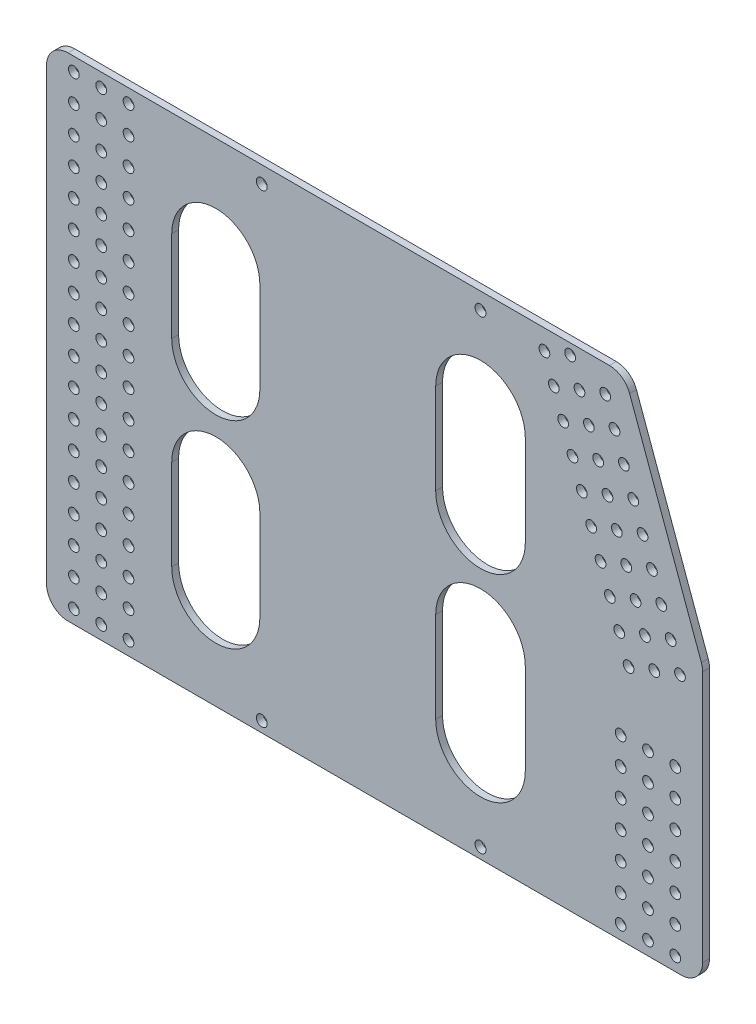
from build123d import *

# Parameters (mm, degrees)
SKETCH3_R           = 2.4892
SKETCH3_R_2         = 14.2875
BOSS_EXTRUDE3_DEPTH = 3.175
FILLET2_R           = 10
BOSS_EXTRUDE5_START = -3.175
SKETCH5_R           = 14.2875
SKETCH5_R_2         = 2.4892
BOSS_EXTRUDE5_DEPTH = 3.175
SKETCH6_R           = 2.54
CUT_EXTRUDE1_DEPTH  = 3.175


with BuildPart() as part:
    # Sketch3 → Boss-Extrude3 (new body)
    with BuildSketch(Plane.XY):
        Polygon((-62.034734806, 275.060295422), (206.435304788, 275.060295422), (242.765265194, 175.244549557), (242.765265194, 46.460295422), (-62.034734806, 46.460295422), align=None)
        with Locations((123.22406409, 114.608841068)):
            Circle(SKETCH3_R, mode=Mode.SUBTRACT)
        with Locations((87.05446409, 114.608841068)):
            Circle(SKETCH3_R, mode=Mode.SUBTRACT)
        with Locations((-49.334734806, 268.710295422)):
            Circle(SKETCH3_R, mode=Mode.SUBTRACT)
        with Locations((-49.334734806, 90.910295422)):
            Circle(SKETCH3_R, mode=Mode.SUBTRACT)
        with Locations((-36.634734806, 268.710295422)):
            Circle(SKETCH3_R, mode=Mode.SUBTRACT)
        with Locations((-23.934734806, 268.710295422)):
            Circle(SKETCH3_R, mode=Mode.SUBTRACT)
        with Locations((-36.634734806, 256.010295422)):
            Circle(SKETCH3_R, mode=Mode.SUBTRACT)
        with Locations((-23.934734806, 256.010295422)):
            Circle(SKETCH3_R, mode=Mode.SUBTRACT)
        with Locations((-36.634734806, 243.310295422)):
            Circle(SKETCH3_R, mode=Mode.SUBTRACT)
        with Locations((-23.934734806, 243.310295422)):
            Circle(SKETCH3_R, mode=Mode.SUBTRACT)
        with Locations((-36.634734806, 230.610295422)):
            Circle(SKETCH3_R, mode=Mode.SUBTRACT)
        with Locations((-23.934734806, 230.610295422)):
            Circle(SKETCH3_R, mode=Mode.SUBTRACT)
        with Locations((-36.634734806, 217.910295422)):
            Circle(SKETCH3_R, mode=Mode.SUBTRACT)
        with Locations((-23.934734806, 217.910295422)):
            Circle(SKETCH3_R, mode=Mode.SUBTRACT)
        with Locations((-36.634734806, 205.210295422)):
            Circle(SKETCH3_R, mode=Mode.SUBTRACT)
        with Locations((-23.934734806, 205.210295422)):
            Circle(SKETCH3_R, mode=Mode.SUBTRACT)
        with Locations((-36.634734806, 192.510295422)):
            Circle(SKETCH3_R, mode=Mode.SUBTRACT)
        with Locations((-23.934734806, 192.510295422)):
            Circle(SKETCH3_R, mode=Mode.SUBTRACT)
        with Locations((-36.634734806, 179.810295422)):
            Circle(SKETCH3_R, mode=Mode.SUBTRACT)
        with Locations((-23.934734806, 179.810295422)):
            Circle(SKETCH3_R, mode=Mode.SUBTRACT)
        with Locations((-36.634734806, 167.110295422)):
            Circle(SKETCH3_R, mode=Mode.SUBTRACT)
        with Locations((-23.934734806, 167.110295422)):
            Circle(SKETCH3_R, mode=Mode.SUBTRACT)
        with Locations((-36.634734806, 154.410295422)):
            Circle(SKETCH3_R, mode=Mode.SUBTRACT)
        with Locations((-23.934734806, 154.410295422)):
            Circle(SKETCH3_R, mode=Mode.SUBTRACT)
        with Locations((-36.634734806, 141.710295422)):
            Circle(SKETCH3_R, mode=Mode.SUBTRACT)
        with Locations((-23.934734806, 141.710295422)):
            Circle(SKETCH3_R, mode=Mode.SUBTRACT)
        with Locations((-36.634734806, 129.010295422)):
            Circle(SKETCH3_R, mode=Mode.SUBTRACT)
        with Locations((-23.934734806, 129.010295422)):
            Circle(SKETCH3_R, mode=Mode.SUBTRACT)
        with Locations((-36.634734806, 116.310295422)):
            Circle(SKETCH3_R, mode=Mode.SUBTRACT)
        with Locations((-23.934734806, 116.310295422)):
            Circle(SKETCH3_R, mode=Mode.SUBTRACT)
        with Locations((-36.634734806, 103.610295422)):
            Circle(SKETCH3_R, mode=Mode.SUBTRACT)
        with Locations((-23.934734806, 103.610295422)):
            Circle(SKETCH3_R, mode=Mode.SUBTRACT)
        with Locations((-36.634734806, 90.910295422)):
            Circle(SKETCH3_R, mode=Mode.SUBTRACT)
        with Locations((-23.934734806, 90.910295422)):
            Circle(SKETCH3_R, mode=Mode.SUBTRACT)
        with Locations((-49.334734806, 256.010295422)):
            Circle(SKETCH3_R, mode=Mode.SUBTRACT)
        with Locations((-49.334734806, 243.310295422)):
            Circle(SKETCH3_R, mode=Mode.SUBTRACT)
        with Locations((-49.334734806, 230.610295422)):
            Circle(SKETCH3_R, mode=Mode.SUBTRACT)
        with Locations((-49.334734806, 217.910295422)):
            Circle(SKETCH3_R, mode=Mode.SUBTRACT)
        with Locations((-49.334734806, 205.210295422)):
            Circle(SKETCH3_R, mode=Mode.SUBTRACT)
        with Locations((-49.334734806, 192.510295422)):
            Circle(SKETCH3_R, mode=Mode.SUBTRACT)
        with Locations((-49.334734806, 179.810295422)):
            Circle(SKETCH3_R, mode=Mode.SUBTRACT)
        with Locations((-49.334734806, 167.110295422)):
            Circle(SKETCH3_R, mode=Mode.SUBTRACT)
        with Locations((-49.334734806, 154.410295422)):
            Circle(SKETCH3_R, mode=Mode.SUBTRACT)
        with Locations((-49.334734806, 141.710295422)):
            Circle(SKETCH3_R, mode=Mode.SUBTRACT)
        with Locations((-49.334734806, 129.010295422)):
            Circle(SKETCH3_R, mode=Mode.SUBTRACT)
        with Locations((-49.334734806, 116.310295422)):
            Circle(SKETCH3_R, mode=Mode.SUBTRACT)
        with Locations((-49.334734806, 103.610295422)):
            Circle(SKETCH3_R, mode=Mode.SUBTRACT)
        with Locations((169.26865969, 265.77786594)):
            Circle(SKETCH3_R, mode=Mode.SUBTRACT)
        with Locations((181.202755974, 270.121521761)):
            Circle(SKETCH3_R, mode=Mode.SUBTRACT)
        with Locations((197.480508078, 262.531081297)):
            Circle(SKETCH3_R, mode=Mode.SUBTRACT)
        with Locations((173.61231551, 253.843769656)):
            Circle(SKETCH3_R, mode=Mode.SUBTRACT)
        with Locations((185.546411794, 258.187425477)):
            Circle(SKETCH3_R, mode=Mode.SUBTRACT)
        with Locations((201.824163899, 250.596985013)):
            Circle(SKETCH3_R, mode=Mode.SUBTRACT)
        with Locations((177.955971331, 241.909673372)):
            Circle(SKETCH3_R, mode=Mode.SUBTRACT)
        with Locations((189.890067615, 246.253329193)):
            Circle(SKETCH3_R, mode=Mode.SUBTRACT)
        with Locations((206.167819719, 238.662888729)):
            Circle(SKETCH3_R, mode=Mode.SUBTRACT)
        with Locations((182.299627151, 229.975577088)):
            Circle(SKETCH3_R, mode=Mode.SUBTRACT)
        with Locations((194.233723435, 234.319232909)):
            Circle(SKETCH3_R, mode=Mode.SUBTRACT)
        with Locations((210.511475539, 226.728792445)):
            Circle(SKETCH3_R, mode=Mode.SUBTRACT)
        with Locations((186.643282971, 218.041480804)):
            Circle(SKETCH3_R, mode=Mode.SUBTRACT)
        with Locations((198.577379255, 222.385136625)):
            Circle(SKETCH3_R, mode=Mode.SUBTRACT)
        with Locations((214.855131359, 214.794696161)):
            Circle(SKETCH3_R, mode=Mode.SUBTRACT)
        with Locations((190.986938791, 206.10738452)):
            Circle(SKETCH3_R, mode=Mode.SUBTRACT)
        with Locations((202.921035075, 210.451040341)):
            Circle(SKETCH3_R, mode=Mode.SUBTRACT)
        with Locations((219.19878718, 202.860599877)):
            Circle(SKETCH3_R, mode=Mode.SUBTRACT)
        with Locations((195.330594612, 194.173288236)):
            Circle(SKETCH3_R, mode=Mode.SUBTRACT)
        with Locations((207.264690896, 198.516944057)):
            Circle(SKETCH3_R, mode=Mode.SUBTRACT)
        with Locations((223.542443, 190.926503593)):
            Circle(SKETCH3_R, mode=Mode.SUBTRACT)
        with Locations((199.674250432, 182.239191952)):
            Circle(SKETCH3_R, mode=Mode.SUBTRACT)
        with Locations((211.608346716, 186.582847773)):
            Circle(SKETCH3_R, mode=Mode.SUBTRACT)
        with Locations((227.88609882, 178.992407309)):
            Circle(SKETCH3_R, mode=Mode.SUBTRACT)
        with Locations((204.017906252, 170.305095668)):
            Circle(SKETCH3_R, mode=Mode.SUBTRACT)
        with Locations((215.952002536, 174.648751489)):
            Circle(SKETCH3_R, mode=Mode.SUBTRACT)
        with Locations((232.22975464, 167.058311025)):
            Circle(SKETCH3_R, mode=Mode.SUBTRACT)
        with Locations((208.361562072, 158.370999384)):
            Circle(SKETCH3_R, mode=Mode.SUBTRACT)
        with Locations((220.295658356, 162.714655205)):
            Circle(SKETCH3_R, mode=Mode.SUBTRACT)
        with Locations((204.665265194, 129.010295422)):
            Circle(SKETCH3_R, mode=Mode.SUBTRACT)
        with Locations((217.365265194, 129.010295422)):
            Circle(SKETCH3_R, mode=Mode.SUBTRACT)
        with Locations((230.065265194, 129.010295422)):
            Circle(SKETCH3_R, mode=Mode.SUBTRACT)
        with Locations((204.665265194, 116.310295422)):
            Circle(SKETCH3_R, mode=Mode.SUBTRACT)
        with Locations((217.365265194, 116.310295422)):
            Circle(SKETCH3_R, mode=Mode.SUBTRACT)
        with Locations((230.065265194, 116.310295422)):
            Circle(SKETCH3_R, mode=Mode.SUBTRACT)
        with Locations((204.665265194, 103.610295422)):
            Circle(SKETCH3_R, mode=Mode.SUBTRACT)
        with Locations((217.365265194, 103.610295422)):
            Circle(SKETCH3_R, mode=Mode.SUBTRACT)
        with Locations((230.065265194, 103.610295422)):
            Circle(SKETCH3_R, mode=Mode.SUBTRACT)
        with Locations((204.665265194, 90.910295422)):
            Circle(SKETCH3_R, mode=Mode.SUBTRACT)
        with Locations((217.365265194, 90.910295422)):
            Circle(SKETCH3_R, mode=Mode.SUBTRACT)
        with Locations((230.065265194, 90.910295422)):
            Circle(SKETCH3_R, mode=Mode.SUBTRACT)
        with Locations((23.601611853, 185.85256672)):
            Circle(SKETCH3_R_2, mode=Mode.SUBTRACT)
        with Locations((52.142163008, 151.05639055)):
            Circle(SKETCH3_R_2, mode=Mode.SUBTRACT)
        with Locations((23.601611853, 116.25656672)):
            Circle(SKETCH3_R_2, mode=Mode.SUBTRACT)
        with Locations((105.13926409, 145.139641068)):
            Circle(SKETCH3_R_2, mode=Mode.SUBTRACT)
        with Locations((104.944740556, 224.82726801)):
            Circle(SKETCH3_R_2, mode=Mode.SUBTRACT)
        with Locations((144.142354475, 181.392565924)):
            Circle(SKETCH3_R_2, mode=Mode.SUBTRACT)
        with Locations((85.284021432, 241.01081705)):
            Circle(SKETCH3_R, mode=Mode.SUBTRACT)
        with Locations((23.601611853, 141.65656672)):
            Circle(SKETCH3_R, mode=Mode.SUBTRACT)
        with Locations((45.598657109, 128.95656672)):
            Circle(SKETCH3_R, mode=Mode.SUBTRACT)
        with Locations((45.598657109, 103.55656672)):
            Circle(SKETCH3_R, mode=Mode.SUBTRACT)
        with Locations((23.601611853, 90.85656672)):
            Circle(SKETCH3_R, mode=Mode.SUBTRACT)
        with Locations((1.604566597, 103.55656672)):
            Circle(SKETCH3_R, mode=Mode.SUBTRACT)
        with Locations((1.604566597, 128.95656672)):
            Circle(SKETCH3_R, mode=Mode.SUBTRACT)
        with Locations((23.601611853, 211.25256672)):
            Circle(SKETCH3_R, mode=Mode.SUBTRACT)
        with Locations((45.598657109, 198.55256672)):
            Circle(SKETCH3_R, mode=Mode.SUBTRACT)
        with Locations((45.598657109, 173.15256672)):
            Circle(SKETCH3_R, mode=Mode.SUBTRACT)
        with Locations((23.601611853, 160.45256672)):
            Circle(SKETCH3_R, mode=Mode.SUBTRACT)
        with Locations((1.604566597, 173.15256672)):
            Circle(SKETCH3_R, mode=Mode.SUBTRACT)
        with Locations((1.604566597, 198.55256672)):
            Circle(SKETCH3_R, mode=Mode.SUBTRACT)
        with Locations((123.22406409, 175.670441068)):
            Circle(SKETCH3_R, mode=Mode.SUBTRACT)
        with Locations((87.05446409, 175.670441068)):
            Circle(SKETCH3_R, mode=Mode.SUBTRACT)
        with Locations((124.606520638, 208.84902209)):
            Circle(SKETCH3_R, mode=Mode.SUBTRACT)
        with Locations((-49.334734806, 78.210295422)):
            Circle(SKETCH3_R, mode=Mode.SUBTRACT)
        with Locations((-36.634734806, 78.210295422)):
            Circle(SKETCH3_R, mode=Mode.SUBTRACT)
        with Locations((-23.934734806, 78.210295422)):
            Circle(SKETCH3_R, mode=Mode.SUBTRACT)
        with Locations((-49.334734806, 65.510295422)):
            Circle(SKETCH3_R, mode=Mode.SUBTRACT)
        with Locations((-36.634734806, 65.510295422)):
            Circle(SKETCH3_R, mode=Mode.SUBTRACT)
        with Locations((-23.934734806, 65.510295422)):
            Circle(SKETCH3_R, mode=Mode.SUBTRACT)
        with Locations((-49.334734806, 52.810295422)):
            Circle(SKETCH3_R, mode=Mode.SUBTRACT)
        with Locations((-36.634734806, 52.810295422)):
            Circle(SKETCH3_R, mode=Mode.SUBTRACT)
        with Locations((-23.934734806, 52.810295422)):
            Circle(SKETCH3_R, mode=Mode.SUBTRACT)
        with Locations((204.665265194, 78.210295422)):
            Circle(SKETCH3_R, mode=Mode.SUBTRACT)
        with Locations((217.365265194, 78.210295422)):
            Circle(SKETCH3_R, mode=Mode.SUBTRACT)
        with Locations((230.065265194, 78.210295422)):
            Circle(SKETCH3_R, mode=Mode.SUBTRACT)
        with Locations((204.665265194, 65.510295422)):
            Circle(SKETCH3_R, mode=Mode.SUBTRACT)
        with Locations((217.365265194, 65.510295422)):
            Circle(SKETCH3_R, mode=Mode.SUBTRACT)
        with Locations((230.065265194, 65.510295422)):
            Circle(SKETCH3_R, mode=Mode.SUBTRACT)
        with Locations((204.665265194, 52.810295422)):
            Circle(SKETCH3_R, mode=Mode.SUBTRACT)
        with Locations((217.365265194, 52.810295422)):
            Circle(SKETCH3_R, mode=Mode.SUBTRACT)
        with Locations((230.065265194, 52.810295422)):
            Circle(SKETCH3_R, mode=Mode.SUBTRACT)
    extrude(amount=BOSS_EXTRUDE3_DEPTH)

    # Fillet2
    fillet2_edges = [part.edges().sort_by_distance(p)[0] for p in [
        (-62.034734806, 275.060295422, 1.5875),
        (-62.034734806, 46.460295422, 1.5875),
        (242.765265194, 46.460295422, 1.5875),
        (242.765265194, 175.244549557, 1.5875),
        (206.435304788, 275.060295422, 1.5875),
    ]]
    fillet(fillet2_edges, radius=FILLET2_R)

    # Sketch5 → Boss-Extrude5 (add)
    with BuildSketch(Plane.XY.offset(3.175).offset(BOSS_EXTRUDE5_START)):
        with Locations((23.601611853, 185.85256672)):
            Circle(SKETCH5_R)
        with Locations((23.601611853, 211.25256672)):
            Circle(SKETCH5_R_2)
        with Locations((45.598657109, 198.55256672)):
            Circle(SKETCH5_R_2)
        with Locations((1.604566597, 198.55256672)):
            Circle(SKETCH5_R_2)
        with Locations((1.604566597, 173.15256672)):
            Circle(SKETCH5_R_2)
        with Locations((23.601611853, 160.45256672)):
            Circle(SKETCH5_R_2)
        with Locations((45.598657109, 173.15256672)):
            Circle(SKETCH5_R_2)
        with Locations((23.601611853, 116.25656672)):
            Circle(SKETCH5_R)
        with Locations((1.604566597, 128.95656672)):
            Circle(SKETCH5_R_2)
        with Locations((23.601611853, 141.65656672)):
            Circle(SKETCH5_R_2)
        with Locations((45.598657109, 128.95656672)):
            Circle(SKETCH5_R_2)
        with Locations((1.604566597, 103.55656672)):
            Circle(SKETCH5_R_2)
        with Locations((23.601611853, 90.85656672)):
            Circle(SKETCH5_R_2)
        with Locations((45.598657109, 103.55656672)):
            Circle(SKETCH5_R_2)
        with Locations((52.142163008, 151.05639055)):
            Circle(SKETCH5_R)
        with Locations((105.13926409, 145.139641068)):
            Circle(SKETCH5_R)
        with Locations((87.05446409, 114.608841068)):
            Circle(SKETCH5_R_2)
        with Locations((123.22406409, 114.608841068)):
            Circle(SKETCH5_R_2)
        with Locations((87.05446409, 175.670441068)):
            Circle(SKETCH5_R_2)
        with Locations((123.22406409, 175.670441068)):
            Circle(SKETCH5_R_2)
        with Locations((144.142354475, 181.392565924)):
            Circle(SKETCH5_R)
        with Locations((104.944740556, 224.82726801)):
            Circle(SKETCH5_R)
        with Locations((124.606520638, 208.84902209)):
            Circle(SKETCH5_R_2)
        with Locations((85.284021432, 241.01081705)):
            Circle(SKETCH5_R_2)
    extrude(amount=BOSS_EXTRUDE5_DEPTH)

    # Sketch6 → Cut-Extrude1 (cut)
    with BuildSketch(Plane.XY.offset(3.175)):
        with Locations((37.965265194, 267.319051793)):
            Circle(SKETCH6_R)
        with Locations((139.565265194, 267.319051793)):
            Circle(SKETCH6_R)
        with Locations((139.565265194, 51.419051793)):
            Circle(SKETCH6_R)
        with Locations((37.965265194, 51.419051793)):
            Circle(SKETCH6_R)
        with BuildLine():
            Line((-3.86420078, 184.234054626), (-3.86420078, 226.372258652))
            ThreePointArc((-3.86420078, 226.372258652), (16.60292689, 246.839386322), (37.070054559, 226.372258652))
            Line((37.070054559, 226.372258652), (37.070054559, 184.234054626))
            ThreePointArc((37.070054559, 184.234054626), (16.60292689, 163.766926957), (-3.86420078, 184.234054626))
        make_face()
        with BuildLine():
            Line((118.756182344, 184.234054626), (118.756182344, 226.372258652))
            ThreePointArc((118.756182344, 226.372258652), (139.565265194, 247.181341502), (160.374348044, 226.372258652))
            Line((160.374348044, 226.372258652), (160.374348044, 184.234054626))
            ThreePointArc((160.374348044, 184.234054626), (139.565265194, 163.424971777), (118.756182344, 184.234054626))
        make_face()
        with BuildLine():
            Line((118.756182344, 134.504048959), (118.756182344, 92.365844933))
            ThreePointArc((118.756182344, 92.365844933), (139.565265194, 71.556762084), (160.374348044, 92.365844933))
            Line((160.374348044, 92.365844933), (160.374348044, 134.504048959))
            ThreePointArc((160.374348044, 134.504048959), (139.565265194, 155.313131809), (118.756182344, 134.504048959))
        make_face()
        with BuildLine():
            Line((-3.86420078, 134.504048959), (-3.86420078, 92.365844933))
            ThreePointArc((-3.86420078, 92.365844933), (16.60292689, 71.898717264), (37.070054559, 92.365844933))
            Line((37.070054559, 92.365844933), (37.070054559, 134.504048959))
            ThreePointArc((37.070054559, 134.504048959), (16.60292689, 154.971176629), (-3.86420078, 134.504048959))
        make_face()
    extrude(amount=-CUT_EXTRUDE1_DEPTH, mode=Mode.SUBTRACT)


solid = part.part
